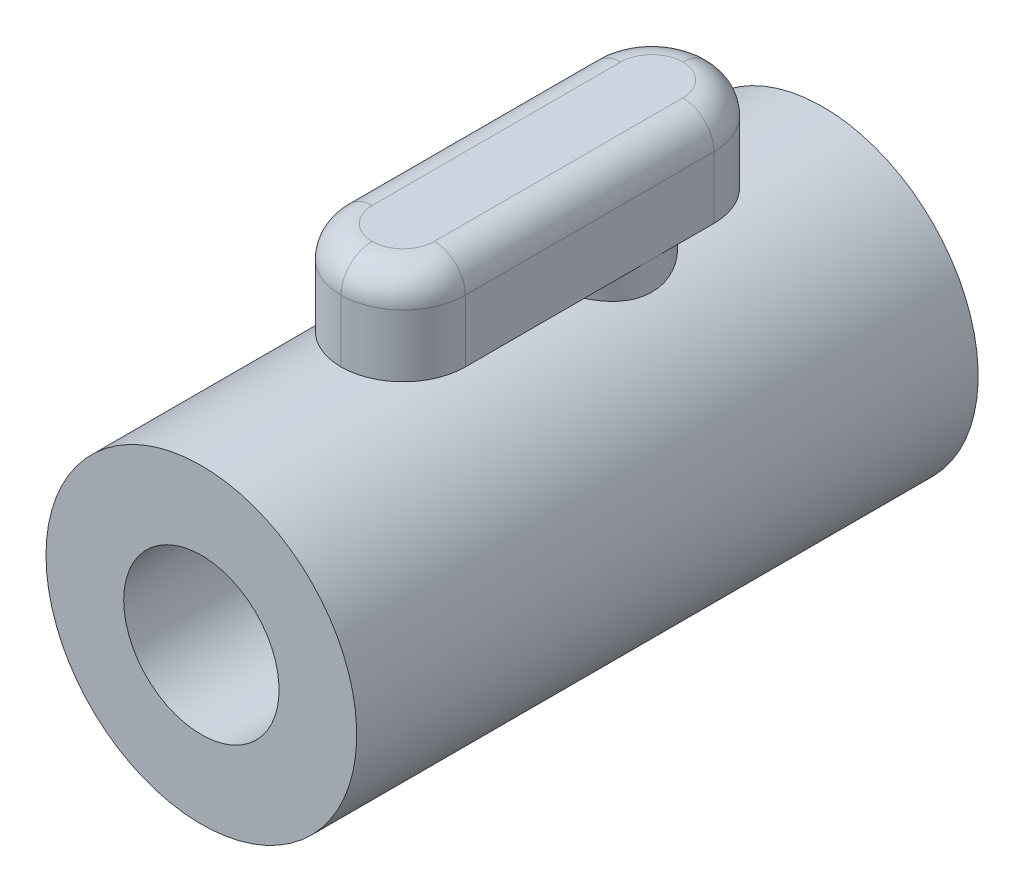
from build123d import *

# Parameters (mm, degrees)
EXTRUDE_THIN6_START      = -10
SKETCH10_R               = 10
SKETCH10_R_2             = 5
EXTRUDE_THIN6_DEPTH      = 40
BOSS_EXTRUDE3_REACH      = 42.311
BOSS_EXTRUDE3_END_RADIUS = 10
SKETCH11_R               = 4
SKETCH12_W               = 4.268669827
SKETCH12_H               = 50.716029666
CUT_EXTRUDE2_DEPTH       = 4
BOSS_EXTRUDE4_START      = -20
SKETCH13_W               = 8
SKETCH13_H               = 6
BOSS_EXTRUDE4_DEPTH      = 24
FILLET3_R                = 4
FILLET4_R                = 2


with BuildPart() as part:
    # Sketch10 → Extrude-Thin6 (new body)
    with BuildSketch(Plane(origin=(0, 0, 0), x_dir=(-1, 0, 0), z_dir=(0, 0, -1)).offset(EXTRUDE_THIN6_START)):
        Circle(SKETCH10_R)
        Circle(SKETCH10_R_2, mode=Mode.SUBTRACT)
    extrude(amount=EXTRUDE_THIN6_DEPTH)

    # Boss-Extrude3: up to this cylinder (the profile starts outside it)
    boss_extrude3_end = Plane(origin=(0, 0, -15), z_dir=(0, 0, 1)) * Cylinder(BOSS_EXTRUDE3_END_RADIUS, 105.622, mode=Mode.PRIVATE)
    # Sketch11 → Boss-Extrude3 (add, up to the surface)
    with BuildSketch(Plane(origin=(0, 15, 0), x_dir=(1, 0, 0), z_dir=(0, 1, 0)), mode=Mode.PRIVATE) as boss_extrude3_sk1:
        with Locations(Location((0, 15, 0), (0, 0, 270))):
            Circle(SKETCH11_R)
    boss_extrude3_tool1 = extrude(boss_extrude3_sk1.sketch, amount=-BOSS_EXTRUDE3_REACH, mode=Mode.PRIVATE) - boss_extrude3_end
    add(boss_extrude3_tool1.solids().sort_by_distance((0, 15, -15))[0])

    # Sketch12 → Cut-Extrude2 (cut)
    with BuildSketch(Plane(origin=(0, 15, 0), x_dir=(1, 0, 0), z_dir=(0, 1, 0))):
        with Locations((-1.865665086, 44.348981699)):
            Rectangle(SKETCH12_W, SKETCH12_H)
    extrude(amount=-CUT_EXTRUDE2_DEPTH, mode=Mode.SUBTRACT)

    # Sketch13 → Boss-Extrude4 (add)
    with BuildSketch(Plane(origin=(0, 0, -18.990966866), x_dir=(-1, 0, 0), z_dir=(0, 0, -1)).offset(BOSS_EXTRUDE4_START)):
        with Locations((0, 14)):
            Rectangle(SKETCH13_W, SKETCH13_H)
    extrude(amount=BOSS_EXTRUDE4_DEPTH)

    # Fillet3
    fillet3_edges = [part.edges().sort_by_distance(p)[0] for p in [
        (4, 14, -22.990966866),
        (-4, 14, 1.009033134),
        (4, 14, 1.009033134),
        (-4, 14, -22.990966866),
    ]]
    fillet(fillet3_edges, radius=FILLET3_R - 0.0001)  # a hair under: the kernel refuses the full size

    # Fillet4
    fillet4_edges = [part.edges().sort_by_distance(p)[0] for p in [
        (-4, 17, -10.990966866),
        (4, 17, -10.990966866),
        (2.828456414, 17, -21.81942328),
        (-2.828456414, 17, -21.81942328),
        (2.828456414, 17, -0.162510452),
        (-2.828456414, 17, -0.162510452),
    ]]
    fillet(fillet4_edges, radius=FILLET4_R - 0.0001)  # a hair under: the kernel refuses the full size


solid = part.part
